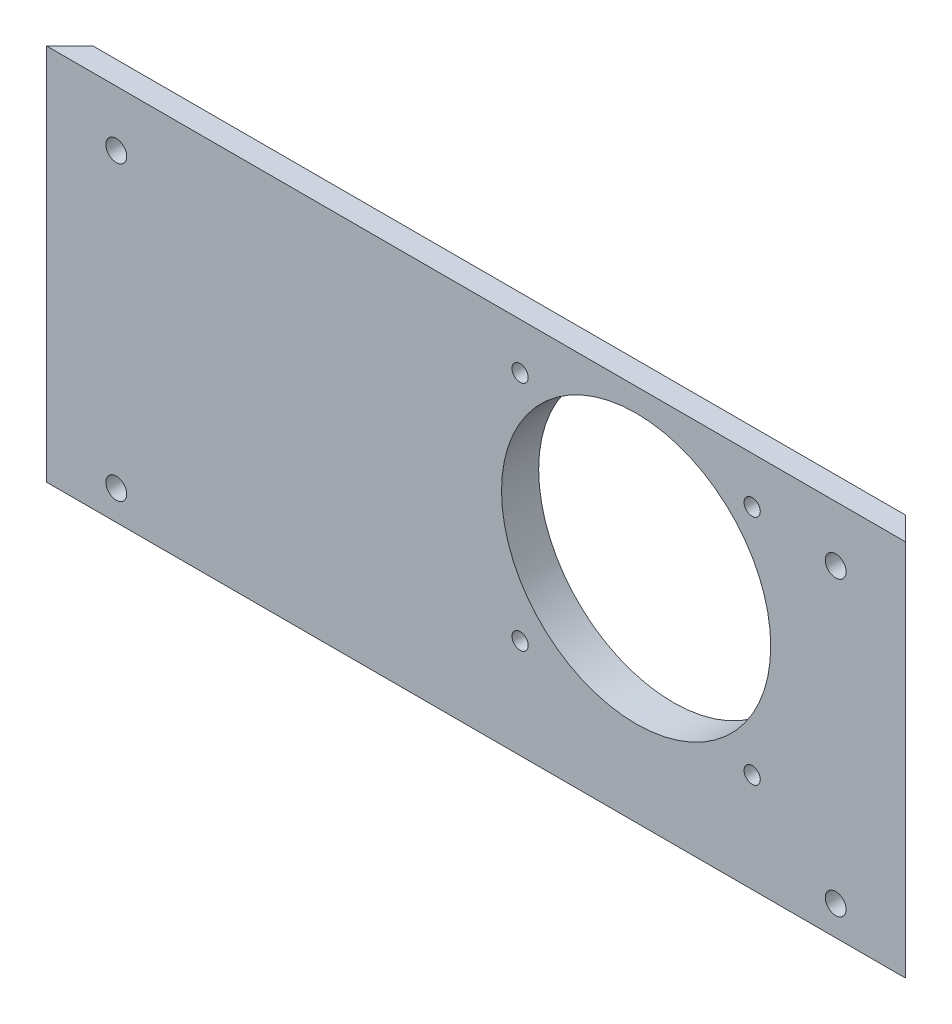
from build123d import *

# Parameters (mm, degrees)
SKETCH1_W           = 185
SKETCH1_H           = 84
SKETCH1_R           = 2.25
BOSS_EXTRUDE1_DEPTH = 5
SKETCH2_W           = 185
SKETCH2_H           = 79
SKETCH2_R           = 2.25
BOSS_EXTRUDE2_DEPTH = 3
CHAMFER1_SIZE       = 8
CHAMFER3_SIZE       = 3
SKETCH3_W           = 7.071067812
SKETCH3_H           = 2.6
CUT_EXTRUDE1_DEPTH  = 221.270985121
SKETCH4_R           = 29
SKETCH4_R_2         = 1.75
CUT_EXTRUDE2_DEPTH  = 204.334699449


with BuildPart() as part:
    # Sketch1 → Boss-Extrude1 (new body)
    with BuildSketch(Plane.XY):
        with Locations((92.5, 42)):
            Rectangle(SKETCH1_W, SKETCH1_H)
        with Locations((15, 9)):
            Circle(SKETCH1_R, mode=Mode.SUBTRACT)
        with Locations(Location((170, 9, 0), (0, 0, 180))):
            Circle(SKETCH1_R, mode=Mode.SUBTRACT)
        with Locations((15, 72)):
            Circle(SKETCH1_R, mode=Mode.SUBTRACT)
        with Locations(Location((170, 72, 0), (0, 0, 180))):
            Circle(SKETCH1_R, mode=Mode.SUBTRACT)
    extrude(amount=-BOSS_EXTRUDE1_DEPTH)

    # Sketch2 → Boss-Extrude2 (add)
    with BuildSketch(Plane(origin=(0, 0, -5), x_dir=(-1, 0, 0), z_dir=(0, 0, -1))):
        with Locations((-92.5, 44.5)):
            Rectangle(SKETCH2_W, SKETCH2_H)
        with Locations(Location((-15, 9, 0), (0, 0, 180))):
            Circle(SKETCH2_R, mode=Mode.SUBTRACT)
        with Locations((-170, 9)):
            Circle(SKETCH2_R, mode=Mode.SUBTRACT)
        with Locations(Location((-15, 72, 0), (0, 0, 180))):
            Circle(SKETCH2_R, mode=Mode.SUBTRACT)
        with Locations((-170, 72)):
            Circle(SKETCH2_R, mode=Mode.SUBTRACT)
    extrude(amount=BOSS_EXTRUDE2_DEPTH)

    # Chamfer1
    # the kernel refuses this chamfer: 8 mm, written as the material it takes off along each edge
    with BuildSketch(Plane(origin=(185, -15.573463904, -8), x_dir=(-0.9996219169112968, 0, -0.027495876610586296), z_dir=(0, 1, 0)), Plane(origin=(0, 104.573463904, -8), x_dir=(0.9996219169112968, 0, -0.027495876610586275), z_dir=(0, -1, 0))) as chamfer1_piece_1:
        Polygon((CHAMFER1_SIZE * 0.999621916911, CHAMFER1_SIZE * 0.0274958766106), (-CHAMFER1_SIZE * 0.0274958766106, CHAMFER1_SIZE * 0.999621916911), (0, 0), align=None)
    extrude(amount=120.146927807, mode=Mode.SUBTRACT)

    # Chamfer3
    chamfer3_edges = [part.edges().sort_by_distance(p)[0] for p in [
        (92.5, 84, -8),
    ]]
    chamfer(chamfer3_edges, length=CHAMFER3_SIZE)

    # Sketch3 → Cut-Extrude1 (cut, through all, along a direction that is not the sketch's normal)
    with BuildSketch(Plane(origin=(92.5, 0, -92.5), x_dir=(-0.7071067811865452, 0, -0.7071067811865498), z_dir=(0.7071067811865498, 0, -0.7071067811865452))):
        with Locations((-127.279220614, 1.3)):
            Rectangle(SKETCH3_W, SKETCH3_H)
    extrude(amount=-CUT_EXTRUDE1_DEPTH, dir=(1, 0, 0), mode=Mode.SUBTRACT)

    # Sketch4 → Cut-Extrude2 (cut, through all)
    with BuildSketch(Plane.XY):
        with Locations((127, 50)):
            Circle(SKETCH4_R)
        with Locations((102, 74)):
            Circle(SKETCH4_R_2)
        with Locations((152, 74)):
            Circle(SKETCH4_R_2)
        with Locations((152, 24)):
            Circle(SKETCH4_R_2)
        with Locations((102, 24)):
            Circle(SKETCH4_R_2)
    extrude(amount=-CUT_EXTRUDE2_DEPTH, mode=Mode.SUBTRACT)


solid = part.part
